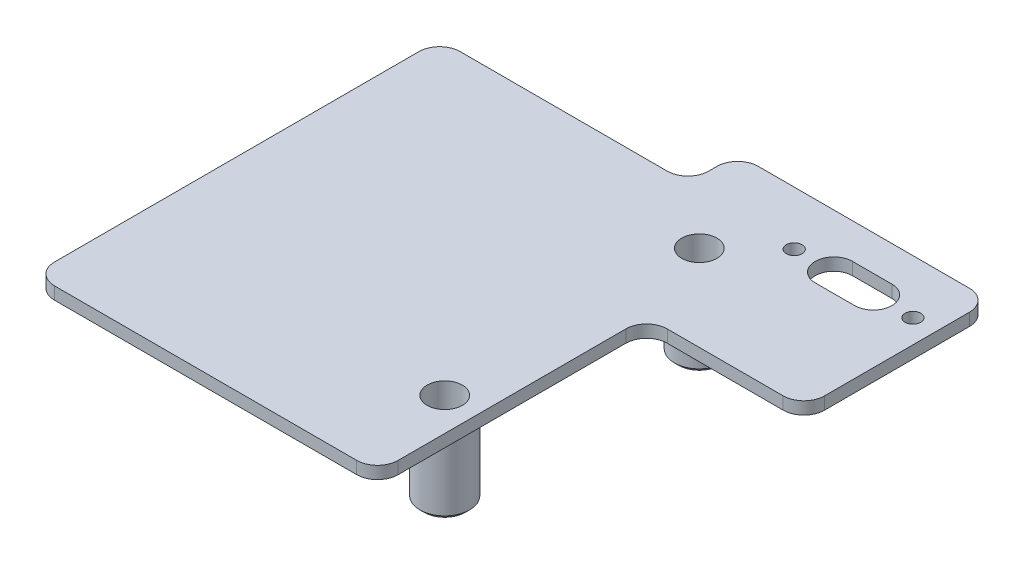
from build123d import *

# Parameters (mm, degrees)
PLATE_DEPTH           = 3
SKETCH2_R             = 6
MOUNT_POSTS_DEPTH     = 22
SKETCH3_R             = 4.25
MOUNT_CBORE_DEPTH     = 19.5
F_8_CLEARANCE_HOLE1_D = 4.4958
FILLET1_R             = 1.5
SKETCH7_R             = 1.9
TERMINAL_STRIP_DEPTH  = 166.90660023
SKETCH9_W             = 60
SKETCH9_H             = 12
WIRING_RELIEF_DEPTH   = 166.90660023
CHAMFER1_SIZE         = 3
CHAMFER2_SIZE         = 1
FILLET2_R             = 5
FILLET3_R             = 1.5


with BuildPart() as part:
    # Sketch1 → plate (new body)
    with BuildSketch(Plane(origin=(0, 0, 0), x_dir=(1, 0, 0), z_dir=(0, 1, 0))):
        Polygon((0, 0), (83, 0), (83, 65), (121, 65), (121, 110), (0, 110), align=None)
    extrude(amount=PLATE_DEPTH)

    # Sketch2 → mount posts (add)
    with BuildSketch(Plane(origin=(0, 3, 0), x_dir=(1, 0, 0), z_dir=(0, 1, 0))):
        with Locations(Location((75, 85.75, 0), (0, 0, 270))):
            Circle(SKETCH2_R)
        with Locations(Location((75, 24.25, 0), (0, 0, 270))):
            Circle(SKETCH2_R)
    extrude(amount=-MOUNT_POSTS_DEPTH)

    # Sketch3 → mount cbore (cut)
    with BuildSketch(Plane(origin=(0, 3, 0), x_dir=(1, 0, 0), z_dir=(0, 1, 0))):
        with Locations(Location((75, 85.75, 0), (0, 0, 270))):
            Circle(SKETCH3_R)
        with Locations(Location((75, 24.25, 0), (0, 0, 270))):
            Circle(SKETCH3_R)
    extrude(amount=-MOUNT_CBORE_DEPTH, mode=Mode.SUBTRACT)

    # #8 Clearance Hole1 (through all)
    with Locations(Plane(origin=(0, -16.5, 0), x_dir=(1, 0, 0), z_dir=(0, 1, 0))):
        with Locations((75, 85.75), (75, 24.25)):
            Hole(F_8_CLEARANCE_HOLE1_D / 2)

    # Sketch8 → foot (revolve)
    with BuildSketch(Plane(origin=(0, 0, -55), x_dir=(1, 0, 0), z_dir=(0, 0, -1)), mode=Mode.PRIVATE) as foot_sk:
        Polygon((47.25, 0), (48.85, 0), (47.1, 25), (45.5, 25), align=None)
    revolve(foot_sk.sketch.rotate(Axis((42, 0, -55), (0, -1, 0)), 90), axis=Axis((42, 0, -55), (0, -1, 0)))

    # Fillet1
    fillet1_edges = [part.edges().sort_by_distance(p)[0] for p in [
        (42, 0, -60.25),
        (42, 0, -61.85),
    ]]
    fillet(fillet1_edges, radius=FILLET1_R)

    # Sketch7 → terminal strip (cut, through all)
    with BuildSketch(Plane(origin=(0, 3, 0), x_dir=(1, 0, 0), z_dir=(0, 1, 0))):
        with Locations(Location((115.34, 97, 0), (0, 0, 270))):
            Circle(SKETCH7_R)
        with Locations(Location((86.66, 97, 0), (0, 0, 270))):
            Circle(SKETCH7_R)
        with BuildLine():
            Line((96.2375, 101.5), (105.7625, 101.5))
            ThreePointArc((105.7625, 101.5), (110.2625, 97), (105.7625, 92.5))
            Line((105.7625, 92.5), (96.2375, 92.5))
            ThreePointArc((96.2375, 92.5), (91.7375, 97), (96.2375, 101.5))
        make_face()
    extrude(amount=-TERMINAL_STRIP_DEPTH, mode=Mode.SUBTRACT)

    # Sketch9 → wiring relief (cut, through all)
    with BuildSketch(Plane(origin=(0, 3, 0), x_dir=(1, 0, 0), z_dir=(0, 1, 0))):
        with Locations((30, 104)):
            Rectangle(SKETCH9_W, SKETCH9_H)
    extrude(amount=-WIRING_RELIEF_DEPTH, mode=Mode.SUBTRACT)

    # Chamfer1
    # the kernel refuses this chamfer: 3 mm, written as the material it adds along each edge
    with BuildSketch(Plane(origin=(75, -16.5, -85.75), x_dir=(0, 0, 1), z_dir=(-1, 0, 0))) as chamfer1_piece_1_section:
        Polygon((4.25, CHAMFER1_SIZE), (4.25 - CHAMFER1_SIZE, 0), (4.25, 0), align=None)
    chamfer1_piece_1 = revolve(axis=Axis((75, -16.5, -85.75), (0, 1, 0)), mode=Mode.PRIVATE)
    chamfer1_piece_1 = chamfer1_piece_1 - Plane(origin=(75, -14.490807126, -85.75), x_dir=(-1, 0, 0), z_dir=(0, -1, 0)) * Cylinder(2.2479, 17, mode=Mode.PRIVATE)
    add(chamfer1_piece_1)
    with BuildSketch(Plane(origin=(75, -16.5, -24.25), x_dir=(0, 0, 1), z_dir=(-1, 0, 0))) as chamfer1_piece_2_section:
        Polygon((4.25, CHAMFER1_SIZE), (4.25 - CHAMFER1_SIZE, 0), (4.25, 0), align=None)
    chamfer1_piece_2 = revolve(axis=Axis((75, -16.5, -24.25), (0, 1, 0)), mode=Mode.PRIVATE)
    chamfer1_piece_2 = chamfer1_piece_2 - Plane(origin=(75, -14.490807126, -24.25), x_dir=(-1, 0, 0), z_dir=(0, -1, 0)) * Cylinder(2.2479, 18, mode=Mode.PRIVATE)
    add(chamfer1_piece_2)

    # Chamfer2
    chamfer2_edges = [part.edges().sort_by_distance(p)[0] for p in [
        (75, -19, -91.75),
        (75, -19, -30.25),
    ]]
    chamfer(chamfer2_edges, length=CHAMFER2_SIZE)

    # Fillet2
    fillet2_edges = [part.edges().sort_by_distance(p)[0] for p in [
        (121, 1.5, -110),
        (121, 1.5, -65),
        (83, 1.5, -65),
        (83, 1.5, 0),
        (0, 1.5, 0),
        (0, 1.5, -98),
        (60, 1.5, -110),
        (60, 1.5, -98),
    ]]
    fillet(fillet2_edges, radius=FILLET2_R)

    # Fillet3
    fillet3_edges = [part.edges().sort_by_distance(p)[0] for p in [
        (75, 0, -91.75),
        (75, 0, -30.25),
    ]]
    fillet(fillet3_edges, radius=FILLET3_R)


solid = part.part
